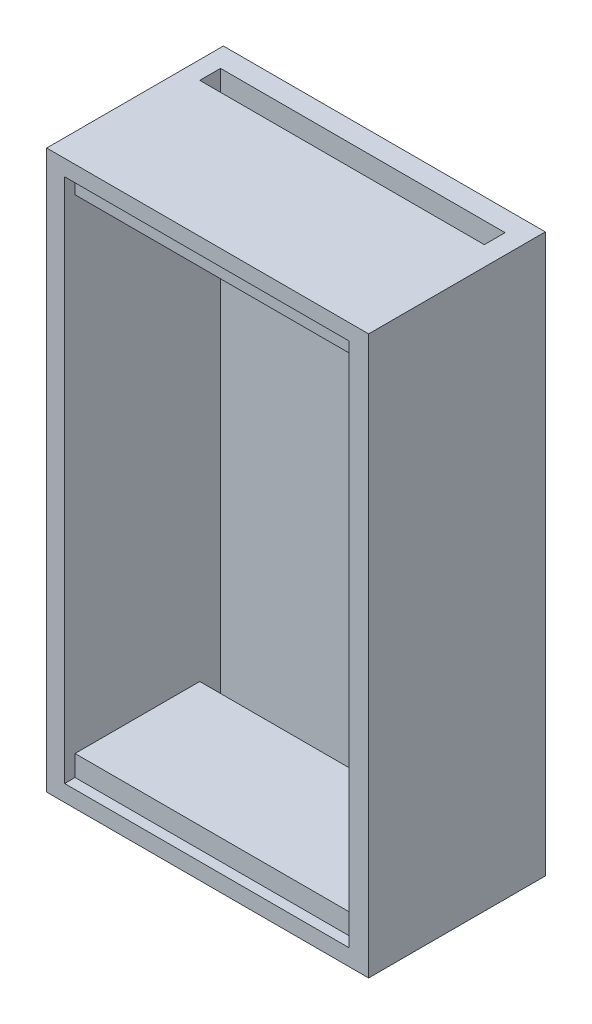
from build123d import *

# Parameters (mm, degrees)
SKETCH_3_W          = 30.974653289
SKETCH_3_H          = 53.672316063
EXTRUDE_1_DEPTH     = 17
SKETCH_5_W          = 27.381586342
SKETCH_5_H          = 50.559171176
CUT_EXTRUDE_1_DEPTH = 15
SKETCH_6_W          = 27.381586342
SKETCH_6_H          = 2
EXTRUDE_2_DEPTH     = 14
SKETCH_8_W          = 27.381586342
SKETCH_8_H          = 2
CUT_EXTRUDE_2_DEPTH = 53


with BuildPart() as part:
    # 草图3 → 凸台-拉伸1 (new body)
    with BuildSketch(Plane.XY):
        with Locations((52.176866004, -51.920270712)):
            Rectangle(SKETCH_3_W, SKETCH_3_H)
    extrude(amount=EXTRUDE_1_DEPTH)

    # 草图5 → 切除-拉伸1 (cut)
    with BuildSketch(Plane.XY.offset(17)):
        with Locations((52.104679946, -51.895727538)):
            Rectangle(SKETCH_5_W, SKETCH_5_H)
    extrude(amount=-CUT_EXTRUDE_1_DEPTH, mode=Mode.SUBTRACT)

    # 草图6 → 凸台-拉伸2 (add)
    with BuildSketch(Plane.XY.offset(2)):
        with Locations((52.104679946, -27.61614195)):
            Rectangle(SKETCH_6_W, SKETCH_6_H)
        with Locations((52.104679946, -76.175313126)):
            Rectangle(SKETCH_6_W, SKETCH_6_H)
    extrude(amount=EXTRUDE_2_DEPTH)

    # 草图8 → 切除-拉伸2 (cut, symmetric)
    with BuildSketch(Plane.XZ.offset(28.61614195)):
        with Locations((52.104679946, 3)):
            Rectangle(SKETCH_8_W, SKETCH_8_H)
    extrude(amount=CUT_EXTRUDE_2_DEPTH, both=True, mode=Mode.SUBTRACT)


solid = part.part
